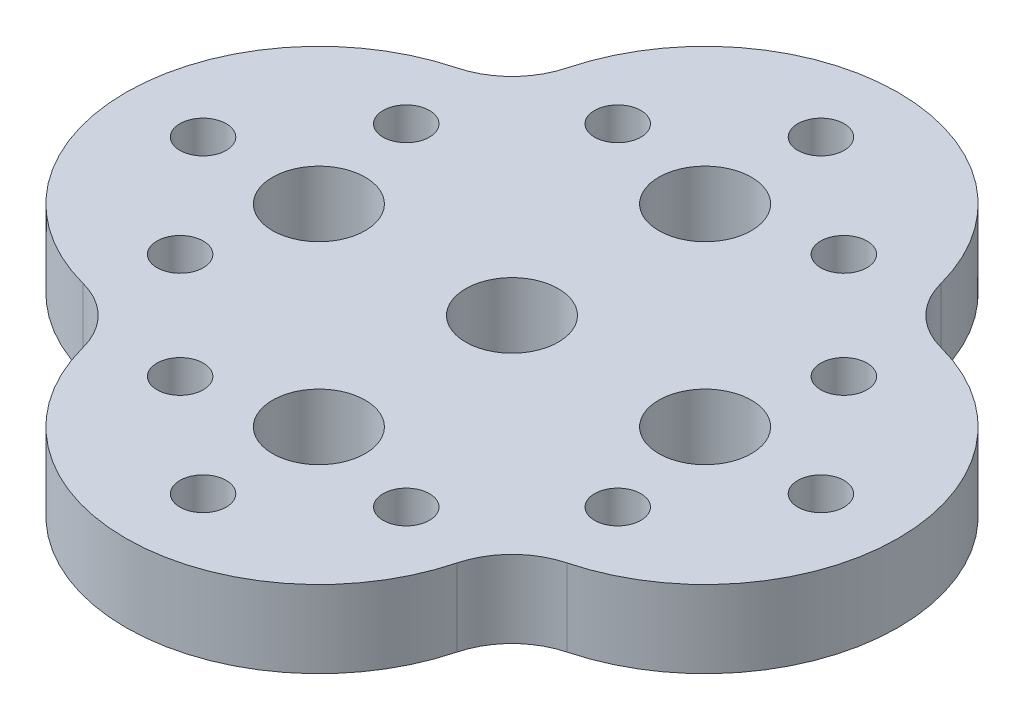
from build123d import *

# Parameters (mm, degrees)
BOSS_EXTRUDE1_DEPTH   = 254
SKETCH7_R             = 76.2
CUT_EXTRUDE2_DEPTH    = 254
CRVPATTERN1_OUTLINE_R = 76.2
CRVPATTERN1_DEPTH     = 254
SKETCH9_R             = 152.4
CUT_EXTRUDE3_DEPTH    = 254
CRVPATTERN2_COUNT     = 4
SKETCH10_R            = 152.4
CUT_EXTRUDE4_DEPTH    = 254


# Read off the part's stored shape, not the designer's step: CrvPattern1
with BuildPart() as part:
    # Sketch1 → Boss-Extrude1 (new body)
    with BuildSketch(Plane(origin=(0, 0, 0), x_dir=(1, 0, 0), z_dir=(0, 1, 0))):
        with BuildLine():
            ThreePointArc((-614.317312734, 795.745884163), (0, 1270), (614.317312734, 795.745884163))
            ThreePointArc((614.317312734, 795.745884163), (680.439115406, 680.439115406), (795.745884163, 614.317312734))
            ThreePointArc((795.745884163, 614.317312734), (1270, 0), (795.745884163, -614.317312734))
            ThreePointArc((795.745884163, -614.317312734), (680.439115406, -680.439115406), (614.317312734, -795.745884163))
            ThreePointArc((614.317312734, -795.745884163), (0, -1270), (-614.317312734, -795.745884163))
            ThreePointArc((-614.317312734, -795.745884163), (-680.439115406, -680.439115406), (-795.745884163, -614.317312734))
            ThreePointArc((-795.745884163, -614.317312734), (-1270, 0), (-795.745884163, 614.317312734))
            ThreePointArc((-795.745884163, 614.317312734), (-680.439115406, 680.439115406), (-614.317312734, 795.745884163))
        make_face()
    extrude(amount=BOSS_EXTRUDE1_DEPTH)

    # Sketch7 → Cut-Extrude2 (cut)
    with BuildSketch(Plane(origin=(0, 254, 0), x_dir=(1, 0, 0), z_dir=(0, 1, 0))):
        with Locations(Location((1016, 0, 0), (0, 0, 270))):
            Circle(SKETCH7_R)
    extrude(amount=-CUT_EXTRUDE2_DEPTH, mode=Mode.SUBTRACT)

    # CrvPattern1 outline → CrvPattern1 (cut)
    with BuildSketch(Plane(origin=(0, 0, 0), x_dir=(1, 0, 0), z_dir=(0, 1, 0))):
        with Locations((719.562357426, 371.854888007)):
            Circle(CRVPATTERN1_OUTLINE_R)
        with Locations((719.562357426, -371.854888007)):
            Circle(CRVPATTERN1_OUTLINE_R)
        with Locations((371.854888007, -719.562357426)):
            Circle(CRVPATTERN1_OUTLINE_R)
        with Locations((0, -1016)):
            Circle(CRVPATTERN1_OUTLINE_R)
        with Locations((-371.854888007, -719.562357426)):
            Circle(CRVPATTERN1_OUTLINE_R)
        with Locations((-719.562357426, -371.854888007)):
            Circle(CRVPATTERN1_OUTLINE_R)
        with Locations((-1016, 0)):
            Circle(CRVPATTERN1_OUTLINE_R)
        with Locations((-719.562357426, 371.854888007)):
            Circle(CRVPATTERN1_OUTLINE_R)
        with Locations((-371.854888007, 719.562357426)):
            Circle(CRVPATTERN1_OUTLINE_R)
        with Locations((0, 1016)):
            Circle(CRVPATTERN1_OUTLINE_R)
        with Locations((371.854888007, 719.562357426)):
            Circle(CRVPATTERN1_OUTLINE_R)
    extrude(amount=CRVPATTERN1_DEPTH, mode=Mode.SUBTRACT)

    # Sketch9 → Cut-Extrude3 (cut)
    with BuildSketch(Plane(origin=(0, 254, 0), x_dir=(1, 0, 0), z_dir=(0, 1, 0))):
        with Locations(Location((0, 635, 0), (0, 0, 270))):
            Circle(SKETCH9_R)
    cut_extrude3 = extrude(amount=-CUT_EXTRUDE3_DEPTH, mode=Mode.SUBTRACT)

    # CrvPattern2: Cut-Extrude3 ×4 about axis
    crvpattern2_axis = Axis((0, 254, 0), (0, 1, 0))
    for i in range(1, CRVPATTERN2_COUNT):
        add(cut_extrude3.rotate(crvpattern2_axis, i * 360 / CRVPATTERN2_COUNT), mode=Mode.SUBTRACT)

    # Sketch10 → Cut-Extrude4 (cut)
    with BuildSketch(Plane(origin=(0, 254, 0), x_dir=(1, 0, 0), z_dir=(0, 1, 0))):
        with Locations(Location((0, 0, 0), (0, 0, 270))):
            Circle(SKETCH10_R)
    extrude(amount=-CUT_EXTRUDE4_DEPTH, mode=Mode.SUBTRACT)


solid = part.part
